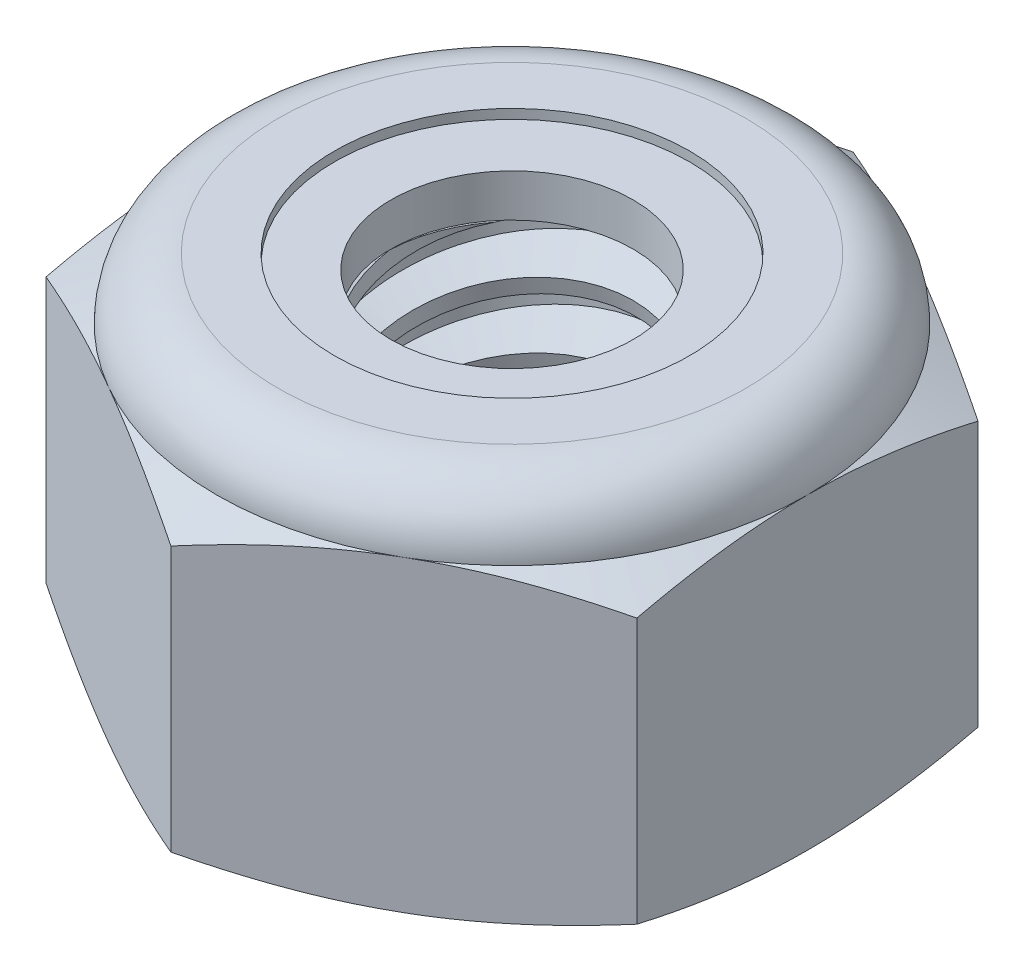
from build123d import *

# Parameters (mm, degrees)
EXTRUDE1_DEPTH       = 5.953125
SKETCH2_W            = 2.413
SKETCH2_H            = 5.953125
LPATTERN1_COUNT      = 6
LPATTERN1_PITCH      = 1.058333333
LPATTERN1_COUNT_DIR2 = 2
LPATTERN1_PITCH_DIR2 = 1.058333333


with BuildPart() as part:
    # Sketch1 → Extrude1 (new body)
    with BuildSketch(Plane(origin=(0, 0, 0), x_dir=(1, 0, 0), z_dir=(0, 1, 0))):
        Polygon((0, 5.499261314), (-4.7625, 2.749630657), (-4.7625, -2.749630657), (0, -5.499261314), (4.7625, -2.749630657), (4.7625, 2.749630657), align=None)
    extrude(amount=EXTRUDE1_DEPTH)

    # Sketch4 → Cut-Revolve2 (revolve, cut)
    with BuildSketch(Plane(origin=(0, 0, 0), x_dir=(0, 0, -1), z_dir=(1, 0, 0))):
        Polygon((0, 5.953125), (2.413, 5.953125), (1.952639712, 5.738455472), (1.952639712, 0.214669528), (2.413, 0), (0, 0), align=None)
    revolve(axis=Axis((0, 5.953125, 0), (0, 1, 0)), mode=Mode.SUBTRACT)


with BuildPart() as body_2:
    # Sketch2 → Revolve1 (revolve)
    with BuildSketch(Plane(origin=(0, 0, 0), x_dir=(0, 0, -1), z_dir=(1, 0, 0))):
        with Locations((1.2065, 2.9765625)):
            Rectangle(SKETCH2_W, SKETCH2_H)
    revolve(axis=Axis((0, -2.413, 0), (0, 1, 0)))

    # Sketch3 → Cut-Revolve1 (revolve, cut)
    with BuildSketch(Plane(origin=(0, 0, 0), x_dir=(0, 0, -1), z_dir=(1, 0, 0))):
        Polygon((2.441337922, 5.823904076), (2.639703376, 4.919357607), (2.009315556, 5.119703115), (1.952639712, 5.378144964), align=None)
    cut_revolve1 = revolve(axis=Axis((0, 5.953125, 0.249698658), (0, -0.976788088344826, -0.2142079141107079)), mode=Mode.SUBTRACT)

    # LPattern1: Cut-Revolve1 6 × 2
    with Locations(*[Vector(0, -1, 0) * (i * LPATTERN1_PITCH) + Vector(0, 1, 0) * (j * LPATTERN1_PITCH_DIR2) for i in range(LPATTERN1_COUNT) for j in range(LPATTERN1_COUNT_DIR2) if (i, j) != (0, 0)]):
        add(cut_revolve1, mode=Mode.SUBTRACT)


with BuildPart() as part_1:
    add(part.part)

    # Combine1: cut body 2
    add(body_2.part, mode=Mode.SUBTRACT)

    # Sketch5 → Cut-Revolve3 (revolve, cut)
    with BuildSketch(Plane(origin=(0, 0, 0), x_dir=(0, 0, -1), z_dir=(1, 0, 0))):
        with BuildLine():
            Line((0, 0), (4.7625, 0))
            Line((4.7625, 0), (5.499261314, 0.343557443))
            Line((5.499261314, 0.343557443), (5.499261314, 4.617380057))
            Line((5.499261314, 4.617380057), (4.7625, 4.9609375))
            ThreePointArc((4.7625, 4.9609375), (4.471895009, 5.662520009), (3.7703125, 5.953125))
            Line((3.7703125, 5.953125), (3.7703125, 7.223125))
            Line((3.7703125, 7.223125), (6.769261314, 7.223125))
            Line((6.769261314, 7.223125), (6.769261314, -1.27))
            Line((6.769261314, -1.27), (0, -1.27))
            Line((0, -1.27), (0, 0))
        make_face()
    revolve(axis=Axis((0, 0, 0), (0, 1, 0)), mode=Mode.SUBTRACT)

    # Sketch6 → Cut-Revolve4 (revolve, cut)
    with BuildSketch(Plane(origin=(0, 0, 0), x_dir=(0, 0, -1), z_dir=(1, 0, 0))):
        with BuildLine():
            Line((0, 4.9609375), (4.6101, 4.9609375))
            ThreePointArc((4.6101, 4.9609375), (4.364131936, 5.554756936), (3.7703125, 5.800725))
            Line((3.7703125, 5.800725), (2.861476106, 5.800725))
            Line((2.861476106, 5.800725), (2.861476106, 7.223125))
            Line((2.861476106, 7.223125), (0, 7.223125))
            Line((0, 7.223125), (0, 4.9609375))
        make_face()
    revolve(axis=Axis((0, 7.223125, 0), (0, 1, 0)), mode=Mode.SUBTRACT)


with BuildPart() as body_2_2:
    # Sketch7 → Revolve2 (revolve)
    with BuildSketch(Plane(origin=(0, 0, 0), x_dir=(0, 0, -1), z_dir=(1, 0, 0))):
        with BuildLine():
            Line((1.952639712, 5.0371375), (4.530088408, 5.0371375))
            ThreePointArc((4.530088408, 5.0371375), (4.282601726, 5.527175629), (3.7703125, 5.724525))
            Line((3.7703125, 5.724525), (1.952639712, 5.724525))
            Line((1.952639712, 5.724525), (1.952639712, 5.0371375))
        make_face()
    revolve(axis=Axis((0, 5.0371375, 0), (0, 1, 0)))


solid = Compound([part_1.part, body_2_2.part])
